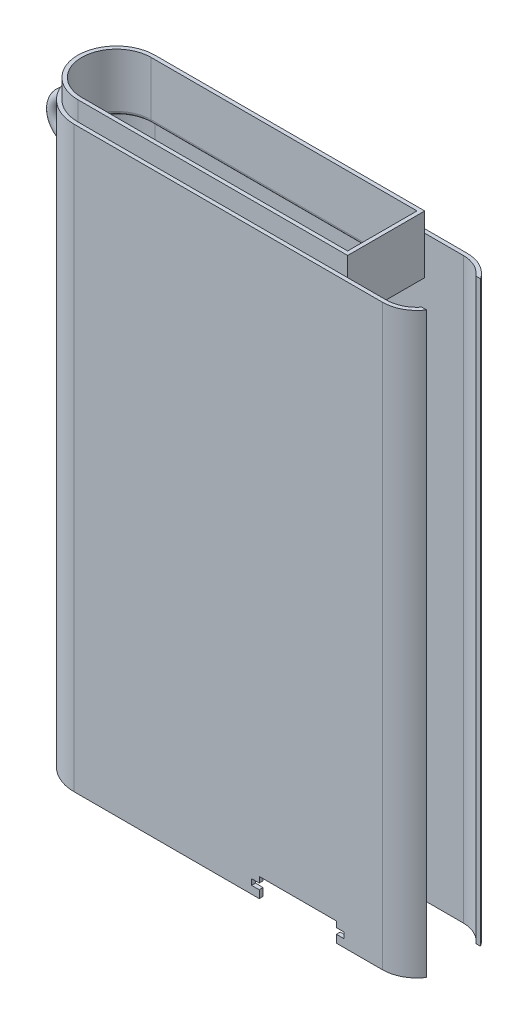
from build123d import *

# Parameters (mm, degrees)
BOSS_EXTRUDE1_DEPTH     = 150
BOSS_EXTRUDE2_DEPTH     = 15
FILLET9_R               = 1
CUT_EXTRUDE1_DEPTH      = 180.338591396
CUT_EXTRUDE1_DEPTH_BACK = 21
SWEEP1_PROFILE_R        = 1.5


with BuildPart() as part:
    # Sketch3 → Boss-Extrude1 (new body)
    with BuildSketch(Plane(origin=(0, 0, 0), x_dir=(1, 0, 0), z_dir=(0, 1, 0))):
        with BuildLine():
            Line((0, 11), (80, 11))
            ThreePointArc((80, 11), (84.242640687, 9.937253933), (87.483314774, 7))
            Line((87.483314774, 7), (86.244997998, 7))
            ThreePointArc((86.244997998, 7), (83.464101615, 9.211102551), (80, 10))
            Line((80, 10), (0, 10))
            ThreePointArc((0, 10), (-10, 0), (0, -10))
            Line((0, -10), (80, -10))
            ThreePointArc((80, -10), (83.464101615, -9.211102551), (86.244997998, -7))
            Line((86.244997998, -7), (87.483314774, -7))
            ThreePointArc((87.483314774, -7), (84.242640687, -9.937253933), (80, -11))
            Line((80, -11), (0, -11))
            ThreePointArc((0, -11), (-11, 0), (0, 11))
        make_face()
    extrude(amount=BOSS_EXTRUDE1_DEPTH)

    # Sketch7 → Cut-Extrude1 (cut, two sides: drawn at the far end of the back side and taken through both)
    with BuildSketch(Plane.XY.offset(11).offset(-CUT_EXTRUDE1_DEPTH_BACK)):
        Polygon((48.06573179, 0), (68.06573179, 0), (68.06573179, 2), (70.06573179, 2), (70.06573179, 3.5), (68.06573179, 3.5), (68.06573179, 5), (48.06573179, 5), (48.06573179, 3.5), (46.06573179, 3.5), (46.06573179, 2), (48.06573179, 2), align=None)
    extrude(amount=CUT_EXTRUDE1_DEPTH + CUT_EXTRUDE1_DEPTH_BACK, mode=Mode.SUBTRACT)


with BuildPart() as body_2:
    # Sketch4 → Boss-Extrude2 (new body)
    with BuildSketch(Plane(origin=(0, 140, 0), x_dir=(1, 0, 0), z_dir=(0, 1, 0))):
        with BuildLine():
            Line((0, 10), (70, 10))
            Line((70, 10), (70, -10))
            Line((70, -10), (0, -10))
            ThreePointArc((0, -10), (-10, 0), (0, 10))
        make_face()
        with BuildLine():
            Line((0, 9), (69, 9))
            Line((69, 9), (69, -9))
            Line((69, -9), (0, -9))
            ThreePointArc((0, -9), (-9, 0), (0, 9))
        make_face(mode=Mode.SUBTRACT)
    extrude(amount=BOSS_EXTRUDE2_DEPTH)

    # Fillet9
    fillet9_edges = [body_2.edges().sort_by_distance(p)[0] for p in [
        (34.5, 140, -9),
        (-9, 140, 0),
        (34.5, 140, 9),
    ]]
    fillet(fillet9_edges, radius=FILLET9_R - 0.0001)  # a hair under: the kernel refuses the full size


with BuildPart() as body_3:
    # Sweep1: sweep along a path in Sketch9
    with BuildLine(Plane.XY) as sweep1_path:
        ThreePointArc((-11, 145), (-16, 140), (-11, 135))
    # Sweep1 profile (on start of the path) → Sweep1 (sweep)
    with BuildSketch(Plane(origin=(-11, 145, 0), x_dir=(0, -1, 0), z_dir=(-1, 0, 0))):
        Circle(SWEEP1_PROFILE_R)
    sweep(path=sweep1_path.line)


solid = Compound([part.part, body_2.part, body_3.part])
